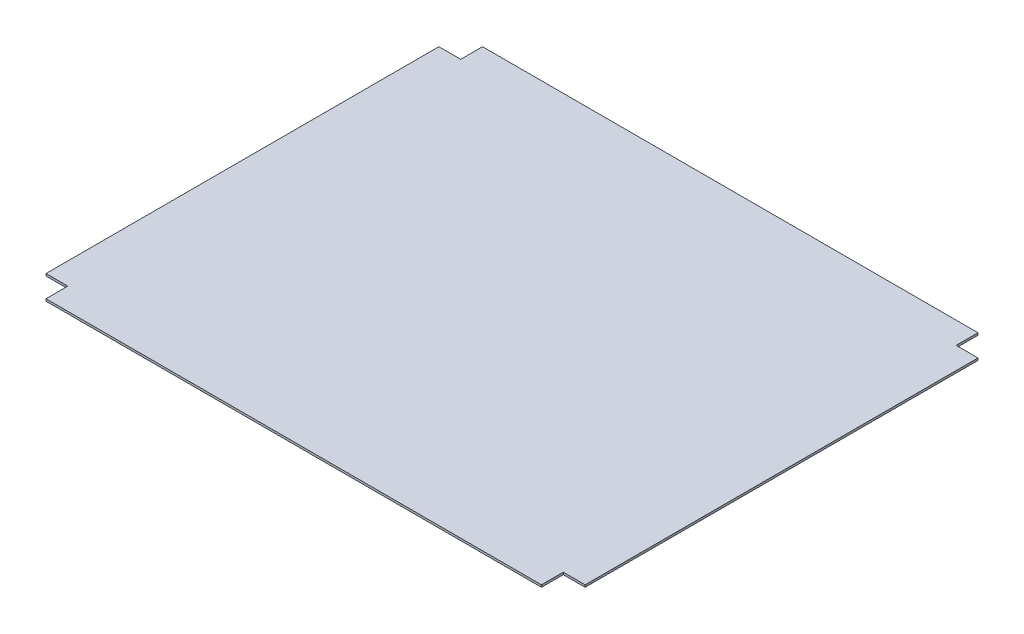
from build123d import *

# Parameters (mm, degrees)
SKETCH2_W          = 494
SKETCH2_H          = 400
BASE_FLANGE1_DEPTH = 2
SKETCH7_W          = 20
SKETCH7_H          = 20
CUT_EXTRUDE1_DEPTH = 10


# Sheet-metal steps are written as plain solids
with BuildPart() as part:
    # Sketch2 → Base-Flange1 (new body)
    with BuildSketch(Plane(origin=(0, 0, 0), x_dir=(1, 0, 0), z_dir=(0, 1, 0))):
        with Locations((0, 200)):
            Rectangle(SKETCH2_W, SKETCH2_H)
    extrude(amount=-BASE_FLANGE1_DEPTH)

    # Sketch7 → Cut-Extrude1 (cut)
    with BuildSketch(Plane(origin=(0, 0, 0), x_dir=(1, 0, 0), z_dir=(0, 1, 0))):
        with Locations((-237, 390)):
            Rectangle(SKETCH7_W, SKETCH7_H)
        with Locations((-237, 10)):
            Rectangle(SKETCH7_W, SKETCH7_H)
        with Locations((237, 10)):
            Rectangle(SKETCH7_W, SKETCH7_H)
        with Locations((237, 390)):
            Rectangle(SKETCH7_W, SKETCH7_H)
    extrude(amount=-CUT_EXTRUDE1_DEPTH, mode=Mode.SUBTRACT)


solid = part.part
